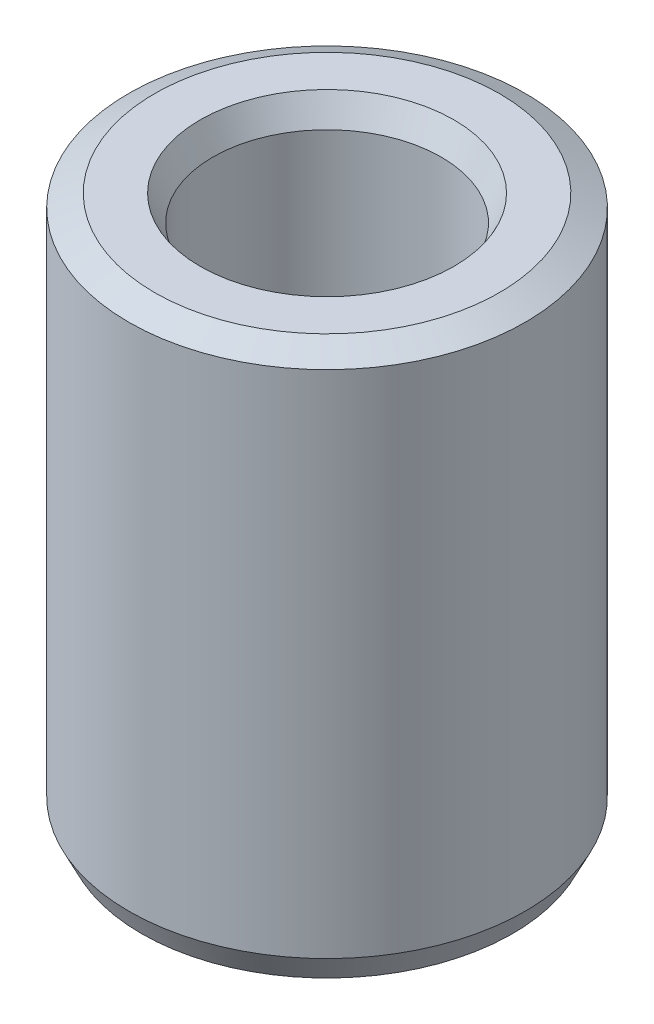
from build123d import *
from OCP.BRepFilletAPI import BRepFilletAPI_MakeChamfer

# Parameters (mm, degrees)
SKETCH1_R           = 57.5
BOSS_EXTRUDE1_DEPTH = 159.11202513
SKETCH2_R           = 33.117039971
CUT_EXTRUDE1_DEPTH  = 179.687259034
CHAMFER1_SIZE       = 3.693242914
CHAMFER1_SIZE2      = 7.497945248


with BuildPart() as part:
    # Sketch1 → Boss-Extrude1 (new body)
    with BuildSketch(Plane(origin=(0, 0, 0), x_dir=(1, 0, 0), z_dir=(0, 1, 0))):
        Circle(SKETCH1_R)
    extrude(amount=BOSS_EXTRUDE1_DEPTH)

    # Sketch2 → Cut-Extrude1 (cut, through all)
    with BuildSketch(Plane(origin=(0, 0, 0), x_dir=(1, 0, 0), z_dir=(0, 1, 0))):
        Circle(SKETCH2_R)
    extrude(amount=CUT_EXTRUDE1_DEPTH, mode=Mode.SUBTRACT)

    # Chamfer1: one chamfer whose edges measure the first distance from different faces: ONE call of the kernel's chamfer builder (chamfer() names one face for all edges)
    chamfer1_edges_1 = [part.edges().sort_by_distance(p)[0] for p in [
        (-33.117039971, 159.11202513, 0),
    ]]
    chamfer1_side_1 = [part.faces().sort_by_distance(p)[0] for p in [
        (-55.873654403, 159.11202513, 0),
    ]]
    chamfer1_edges_2 = [part.edges().sort_by_distance(p)[0] for p in [
        (-33.117039971, 0, 0),
    ]]
    chamfer1_side_2 = [part.faces().sort_by_distance(p)[0] for p in [
        (-33.117039971, 79.556012565, 0),
    ]]
    chamfer1_edges_3 = [part.edges().sort_by_distance(p)[0] for p in [
        (-57.5, 0, 0),
    ]]
    chamfer1_side_3 = [part.faces().sort_by_distance(p)[0] for p in [
        (-55.873654403, 0, 0),
    ]]
    chamfer1_edges_4 = [part.edges().sort_by_distance(p)[0] for p in [
        (-57.5, 159.11202513, 0),
    ]]
    chamfer1_side_4 = [part.faces().sort_by_distance(p)[0] for p in [
        (-57.5, 79.556012565, 0),
    ]]
    chamfer1 = BRepFilletAPI_MakeChamfer(part.part.solid().wrapped)
    for e in chamfer1_edges_1:
        chamfer1.Add(CHAMFER1_SIZE, CHAMFER1_SIZE2, e.wrapped, chamfer1_side_1[0].wrapped)  # the first distance lies on this face
    for e in chamfer1_edges_2:
        chamfer1.Add(CHAMFER1_SIZE, CHAMFER1_SIZE2, e.wrapped, chamfer1_side_2[0].wrapped)  # the first distance lies on this face
    for e in chamfer1_edges_3:
        chamfer1.Add(CHAMFER1_SIZE, CHAMFER1_SIZE2, e.wrapped, chamfer1_side_3[0].wrapped)  # the first distance lies on this face
    for e in chamfer1_edges_4:
        chamfer1.Add(CHAMFER1_SIZE, CHAMFER1_SIZE2, e.wrapped, chamfer1_side_4[0].wrapped)  # the first distance lies on this face
    add(Compound.cast(chamfer1.Shape()), mode=Mode.REPLACE)


solid = part.part
